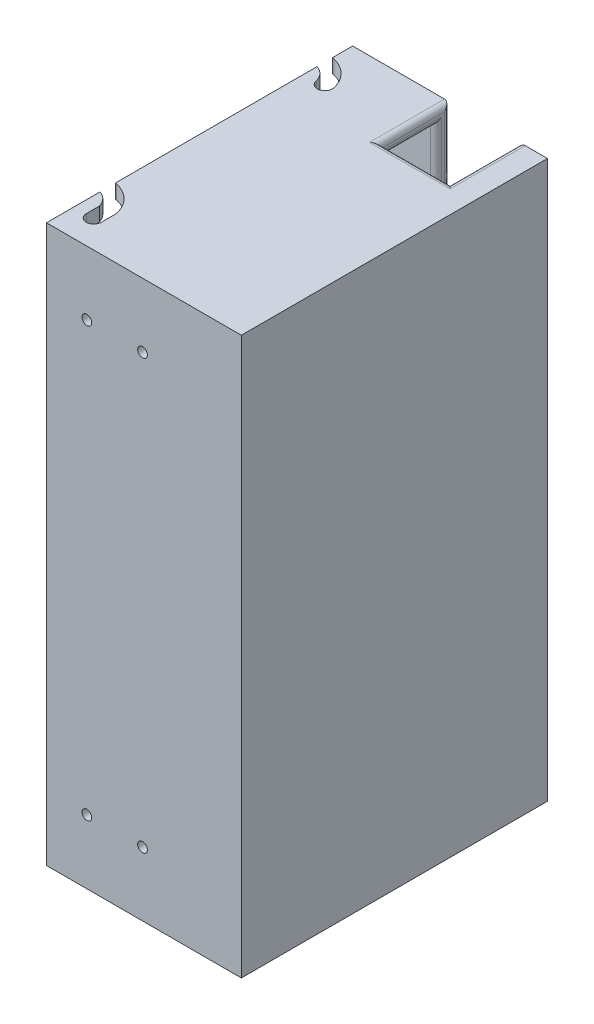
from build123d import *

# Parameters (mm, degrees)
ESQUISSE1_W             = 70
ESQUISSE1_H             = 200
BOSS_EXTRU_1_DEPTH      = 5
BOSS_EXTRU_2_DEPTH      = 100
ESQUISSE3_W             = 70
ESQUISSE3_H             = 200
BOSS_EXTRU_3_DEPTH      = 5
ENL_V_MAT_EXTRU_2_DEPTH = 5
CONG_3_R                = 1
ESQUISSE7_R             = 1.75
ENL_V_MAT_EXTRU_4_DEPTH = 5
ENL_V_MAT_EXTRU_5_DEPTH = 2
ESQUISSE9_W             = 25
ESQUISSE9_H             = 25
ENL_V_MAT_EXTRU_6_DEPTH = 25
CONG_4_R                = 2


with BuildPart() as part:
    # Esquisse1 → Boss.-Extru.1 (new body)
    with BuildSketch(Plane.XY):
        with Locations((-35, 100)):
            Rectangle(ESQUISSE1_W, ESQUISSE1_H)
    extrude(amount=BOSS_EXTRU_1_DEPTH)

    # Esquisse2 → Boss.-Extru.2 (add)
    with BuildSketch(Plane.XY.offset(5)):
        Polygon((0, 0), (-70, 0), (-70, 5), (-5, 5), (-5, 195), (-70, 195), (-70, 200), (0, 200), align=None)
    extrude(amount=BOSS_EXTRU_2_DEPTH)

    # Esquisse3 → Boss.-Extru.3 (add)
    with BuildSketch(Plane.XY.offset(105)):
        with Locations((-35, 100)):
            Rectangle(ESQUISSE3_W, ESQUISSE3_H)
    extrude(amount=BOSS_EXTRU_3_DEPTH)

    # Esquisse5 → Enlèv. mat.-Extru.2 (cut)
    with BuildSketch(Plane.XZ):
        with BuildLine():
            ThreePointArc((-65.636494811, 17.582146985), (-67.179174329, 14.605555398), (-70, 12.793677891))
            Line((-70, 12.793677891), (-70, 7.3))
            ThreePointArc((-70, 7.3), (-69.707199718, 7.315923251), (-69.417853015, 7.363505189))
            ThreePointArc((-69.417853015, 7.363505189), (-63.569041252, 10.569041252), (-60.363505189, 16.417853015))
            ThreePointArc((-60.363505189, 16.417853015), (-62.417853015, 19.636494811), (-65.636494811, 17.582146985))
        make_face()
        with BuildLine():
            ThreePointArc((-60.363505189, 94.417853015), (-63.292800282, 92.315923251), (-65.7, 95))
            Line((-65.7, 95), (-65.7, 95.320415964))
            ThreePointArc((-65.7, 95.320415964), (-67.270907084, 92.506959978), (-70, 90.793677891))
            Line((-70, 90.793677891), (-70, 85.3))
            ThreePointArc((-70, 85.3), (-69.707199718, 85.315923251), (-69.417853015, 85.363505189))
            ThreePointArc((-69.417853015, 85.363505189), (-63.569041252, 88.569041252), (-60.363505189, 94.417853015))
        make_face()
        with BuildLine():
            Line((-65.7, 95.320415964), (-65.7, 95))
            ThreePointArc((-65.7, 95), (-63.292800282, 92.315923251), (-60.363505189, 94.417853015))
            ThreePointArc((-60.363505189, 94.417853015), (-60.315923251, 94.707199718), (-60.3, 95))
            ThreePointArc((-60.3, 95), (-62.707199718, 97.684076749), (-65.636494811, 95.582146985))
            ThreePointArc((-65.636494811, 95.582146985), (-65.666891669, 95.450952525), (-65.7, 95.320415964))
        make_face()
        with BuildLine():
            Line((-65.7, 100), (-65.7, 95.320415964))
            ThreePointArc((-65.7, 95.320415964), (-65.666891669, 95.450952525), (-65.636494811, 95.582146985))
            ThreePointArc((-65.636494811, 95.582146985), (-62.707199718, 97.684076749), (-60.3, 95))
            Line((-60.3, 95), (-60.3, 100))
            ThreePointArc((-60.3, 100), (-63, 102.7), (-65.7, 100))
        make_face()
    enl_v_mat_extru_2 = extrude(amount=-ENL_V_MAT_EXTRU_2_DEPTH, mode=Mode.SUBTRACT)

    # Symétrie1: Enlèv. mat.-Extru.2 across plane
    add(enl_v_mat_extru_2.mirror(Plane.ZX.offset(100)), mode=Mode.SUBTRACT)

    # Congé3
    cong_3_edges = [part.edges().sort_by_distance(p)[0] for p in [
        (-70, 2.5, 90.793677891),
        (-70, 2.5, 85.3),
        (-70, 2.5, 12.793677891),
        (-70, 2.5, 7.3),
    ]]
    fillet(cong_3_edges, radius=CONG_3_R)

    # Esquisse7 → Enlèv. mat.-Extru.4 (cut)
    with BuildSketch(Plane.XY.offset(110)):
        with Locations((-55.5, 23)):
            Circle(ESQUISSE7_R)
        with Locations((-35.5, 23)):
            Circle(ESQUISSE7_R)
        with Locations((-55.5, 177)):
            Circle(ESQUISSE7_R)
        with Locations((-35.5, 177)):
            Circle(ESQUISSE7_R)
    extrude(amount=-ENL_V_MAT_EXTRU_4_DEPTH, mode=Mode.SUBTRACT)

    # Esquisse8 → Enlèv. mat.-Extru.5 (cut)
    with BuildSketch(Plane(origin=(0, 0, 105), x_dir=(-1, 0, 0), z_dir=(0, 0, -1))):
        Polygon((33.854551733, 25.85), (37.145448267, 25.85), (38.790896534, 23), (37.145448267, 20.15), (33.854551733, 20.15), (32.209103466, 23), align=None)
        Polygon((53.854551733, 25.85), (57.145448267, 25.85), (58.790896534, 23), (57.145448267, 20.15), (53.854551733, 20.15), (52.209103466, 23), align=None)
        Polygon((52.209103466, 177), (53.854551733, 174.15), (57.145448267, 174.15), (58.790896534, 177), (57.145448267, 179.85), (53.854551733, 179.85), align=None)
        Polygon((32.209103466, 177), (33.854551733, 174.15), (37.145448267, 174.15), (38.790896534, 177), (37.145448267, 179.85), (33.854551733, 179.85), align=None)
    extrude(amount=-ENL_V_MAT_EXTRU_5_DEPTH, mode=Mode.SUBTRACT)

    # Esquisse9 → Enlèv. mat.-Extru.6 (cut)
    with BuildSketch(Plane(origin=(0, 0, 0), x_dir=(-1, 0, 0), z_dir=(0, 0, -1))):
        with Locations((22.5, 187.5)):
            Rectangle(ESQUISSE9_W, ESQUISSE9_H)
    extrude(amount=-ENL_V_MAT_EXTRU_6_DEPTH, mode=Mode.SUBTRACT)

    # Congé4
    cong_4_edges = [part.edges().sort_by_distance(p)[0] for p in [
        (-35, 185, 5),
        (-22.5, 175, 5),
        (-10, 185, 5),
        (-10, 195, 15),
        (-22.5, 200, 25),
        (-22.5, 195, 25),
        (-35, 200, 12.5),
        (-35, 195, 15),
        (-10, 200, 12.5),
        (-10, 187.5, 0),
        (-35, 187.5, 0),
        (-22.5, 175, 0),
    ]]
    fillet(cong_4_edges, radius=CONG_4_R)


solid = part.part
